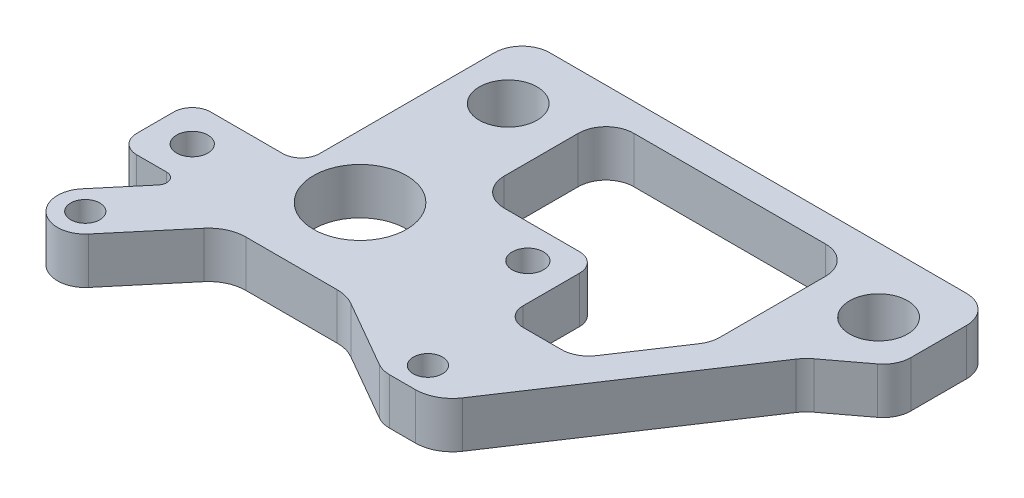
from build123d import *

# Parameters (mm, degrees)
SKETCH4_R           = 6.3881
SKETCH4_R_2         = 3.96875
SKETCH4_R_3         = 2
SKETCH4_R_4         = 2.1463
BOSS_EXTRUDE2_DEPTH = 6.35
FILLET1_R           = 5.08
FILLET7_R           = 3.81
FILLET9_R           = 5.08
FILLET10_R          = 1.27
FILLET11_R          = 3.81
FILLET12_R          = 2.54
FILLET13_R          = 3.81


with BuildPart() as part:
    # Sketch4 → Boss-Extrude2 (new body)
    with BuildSketch(Plane(origin=(0, 0, 0), x_dir=(1, 0, 0), z_dir=(0, 1, 0))):
        with BuildLine():
            Line((28.735494078, -18.4375), (22.483900583, -18.4375))
            ThreePointArc((22.483900583, -18.4375), (21.500464498, -18.308390309), (20.583679925, -17.929811531))
            Line((20.583679925, -17.929811531), (10.16293305, -11.933490986))
            Line((10.16293305, -11.933490986), (-6.103062549, -11.933490986))
            Line((-6.103062549, -11.933490986), (-17.314513469, -25.273959881))
            Line((-17.314513469, -25.273959881), (-23.148009155, -20.371437257))
            Line((-23.148009155, -20.371437257), (-14.139296969, -9.652))
            Line((-14.139296969, -9.652), (-23.52171402, -9.652))
            Line((-23.52171402, -9.652), (-23.52171402, 0.508))
            Line((-23.52171402, 0.508), (-8.5725, 0.508))
            Line((-8.5725, 0.508), (-8.5725, 12.607500122))
            Line((-8.5725, 12.607500122), (-8.5725, 26.9875))
            ThreePointArc((-8.5725, 26.9875), (-7.456576836, 29.681576836), (-4.7625, 30.7975))
            Line((-4.7625, 30.7975), (52.3875, 30.7975))
            ThreePointArc((52.3875, 30.7975), (55.081576836, 29.681576836), (56.1975, 26.9875))
            Line((56.1975, 26.9875), (56.1975, 19.362095927))
            ThreePointArc((56.1975, 19.362095927), (55.797199918, 17.662082259), (54.680415238, 16.319294633))
            Line((54.680415238, 16.319294633), (48.985566477, 12.027918285))
            Line((48.985566477, 12.027918285), (28.735494078, -18.4375))
        make_face()
        with Locations(Location((0, 0, 0), (0, 0, 270))):
            Circle(SKETCH4_R, mode=Mode.SUBTRACT)
        with Locations(Location((-1.5875, 21.9075, 0), (0, 0, 270))):
            Circle(SKETCH4_R_2, mode=Mode.SUBTRACT)
        with Locations(Location((49.2125, 21.9075, 0), (0, 0, 270))):
            Circle(SKETCH4_R_2, mode=Mode.SUBTRACT)
        with Locations(Location((24.012521227, -14.703599027, 0), (0, 0, 270))):
            Circle(SKETCH4_R_3, mode=Mode.SUBTRACT)
        with Locations(Location((-17.78, -19.905950726, 0), (0, 0, 270))):
            Circle(SKETCH4_R_3, mode=Mode.SUBTRACT)
        with Locations(Location((18.44171402, 4.572, 0), (0, 0, 270))):
            Circle(SKETCH4_R_4, mode=Mode.SUBTRACT)
        with Locations(Location((-18.44171402, -4.572, 0), (0, 0, 270))):
            Circle(SKETCH4_R_4, mode=Mode.SUBTRACT)
        Polygon((6.749565973, 26.9875), (40.692955064, 26.9875), (40.692955064, 7.472580753), (33.28904903, -3.666297657), (23.452955064, -3.666297657), (23.452955064, 9.2075), (6.749565973, 9.2075), align=None, mode=Mode.SUBTRACT)
    extrude(amount=-BOSS_EXTRUDE2_DEPTH)

    # Fillet1
    fillet1_edges = [part.edges().sort_by_distance(p)[0] for p in [
        (48.985566477, -3.175, -12.027918285),
        (28.735494078, -3.175, 18.4375),
    ]]
    fillet(fillet1_edges, radius=FILLET1_R)

    # Fillet7
    fillet7_edges = [part.edges().sort_by_distance(p)[0] for p in [
        (40.692955064, -3.175, -7.472580753),
        (40.692955064, -3.175, -26.9875),
        (6.749565973, -3.175, -26.9875),
        (6.749565973, -3.175, -9.2075),
    ]]
    fillet(fillet7_edges, radius=FILLET7_R)

    # Fillet9
    fillet9_edges = [part.edges().sort_by_distance(p)[0] for p in [
        (10.16293305, -3.175, 11.933490986),
        (-6.103062549, -3.175, 11.933490986),
    ]]
    fillet(fillet9_edges, radius=FILLET9_R)

    # Fillet10
    fillet10_edges = [part.edges().sort_by_distance(p)[0] for p in [
        (-14.139296969, -3.175, 9.652),
    ]]
    fillet(fillet10_edges, radius=FILLET10_R)

    # Fillet11
    fillet11_edges = [part.edges().sort_by_distance(p)[0] for p in [
        (-17.314513469, -3.175, 25.273959881),
        (-23.148009155, -3.175, 20.371437257),
    ]]
    fillet(fillet11_edges, radius=FILLET11_R - 0.0001)  # a hair under: the kernel refuses the full size

    # Fillet12
    fillet12_edges = [part.edges().sort_by_distance(p)[0] for p in [
        (23.452955064, -3.175, -9.2075),
        (23.452955064, -3.175, 3.666297657),
        (-23.52171402, -3.175, 9.652),
        (-23.52171402, -3.175, -0.508),
        (-8.5725, -3.175, -0.508),
    ]]
    fillet(fillet12_edges, radius=FILLET12_R)

    # Fillet13
    fillet13_edges = [part.edges().sort_by_distance(p)[0] for p in [
        (33.28904903, -3.175, 3.666297657),
    ]]
    fillet(fillet13_edges, radius=FILLET13_R)


solid = part.part
